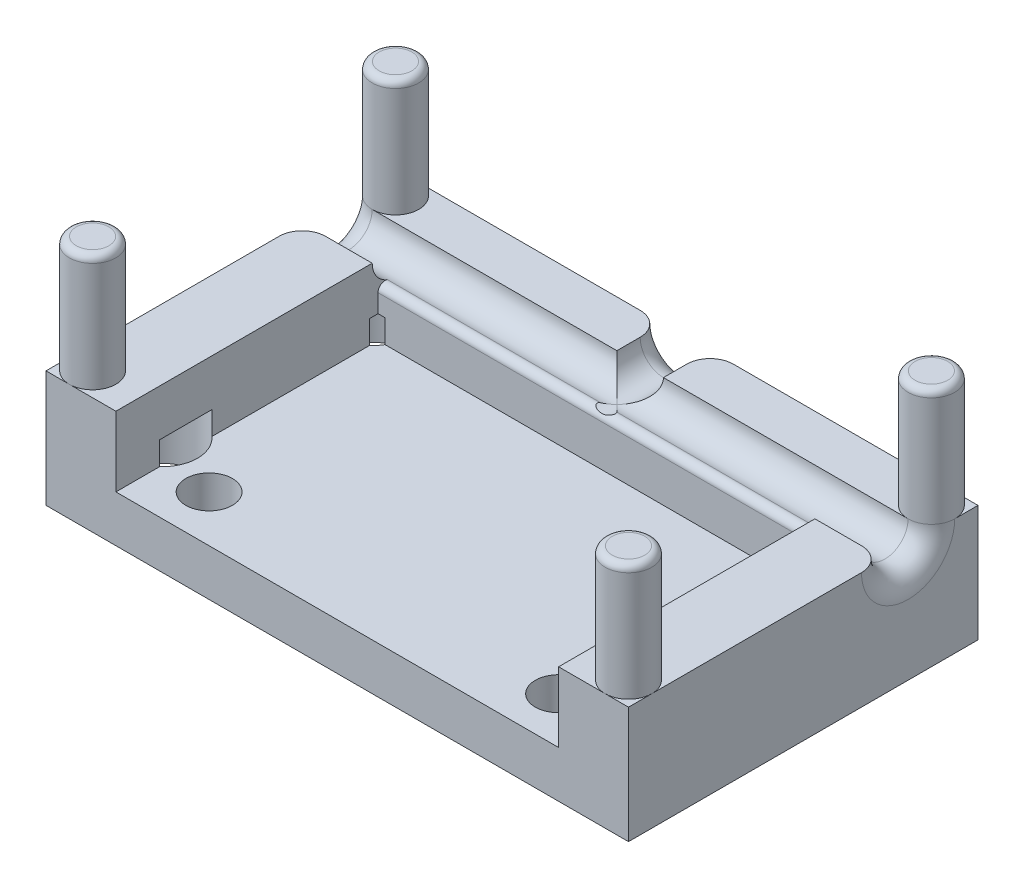
from build123d import *

# Parameters (mm, degrees)
SKETCH1_W               = 25
SKETCH1_H               = 15
BOSS_EXTRUDE1_DEPTH     = 5
CUT_EXTRUDE1_DEPTH      = 27.575364532
CUT_EXTRUDE1_DEPTH_BACK = 27.575364532
SKETCH2_R               = 1
FILLET1_R               = 1
SKETCH3_R               = 1
BOSS_EXTRUDE2_DEPTH     = 5
SKETCH4_W               = 19
SKETCH4_H               = 11.25
CUT_EXTRUDE2_DEPTH      = 3
SKETCH5_R               = 1
CUT_EXTRUDE3_DEPTH      = 3
FILLET2_R               = 0.3
FILLET3_R               = 0.3
CUT_EXTRUDE4_DEPTH      = 18.677669643
CUT_EXTRUDE4_DEPTH_BACK = 3
SKETCH6_R               = 1.5
CUT_EXTRUDE5_DEPTH      = 22.937411094
CUT_EXTRUDE5_DEPTH_BACK = 22.937411094
SKETCH7_R               = 1
FILLET4_R               = 1


with BuildPart() as part:
    # Sketch1 → Boss-Extrude1 (new body)
    with BuildSketch(Plane(origin=(0, 0, 0), x_dir=(1, 0, 0), z_dir=(0, 1, 0))):
        Rectangle(SKETCH1_W, SKETCH1_H)
    extrude(amount=BOSS_EXTRUDE1_DEPTH)

    # Sketch2 → Cut-Extrude1 (cut, two sides: drawn at the far end of the back side and taken through both)
    with BuildSketch(Plane.ZY.offset(12.5).offset(-CUT_EXTRUDE1_DEPTH_BACK)):
        with Locations((-4.5, 5)):
            Circle(SKETCH2_R)
    extrude(amount=CUT_EXTRUDE1_DEPTH + CUT_EXTRUDE1_DEPTH_BACK, mode=Mode.SUBTRACT)

    # Fillet1
    fillet1_edges = [part.edges().sort_by_distance(p)[0] for p in [
        (12.5, 4, -4.5),
        (-12.5, 4, -4.5),
    ]]
    fillet(fillet1_edges, radius=FILLET1_R)

    # Sketch3 → Boss-Extrude2 (add)
    with BuildSketch(Plane(origin=(0, 5, 0), x_dir=(1, 0, 0), z_dir=(0, 1, 0))):
        with Locations((-11.5, 6.5)):
            Circle(SKETCH3_R)
        with Locations((11.5, 6.5)):
            Circle(SKETCH3_R)
        with Locations((11.5, -6.5)):
            Circle(SKETCH3_R)
        with Locations((-11.5, -6.5)):
            Circle(SKETCH3_R)
    extrude(amount=BOSS_EXTRUDE2_DEPTH)

    # Sketch4 → Cut-Extrude2 (cut)
    with BuildSketch(Plane(origin=(0, 5, 0), x_dir=(1, 0, 0), z_dir=(0, 1, 0))):
        with Locations((0, -1.875)):
            Rectangle(SKETCH4_W, SKETCH4_H)
    extrude(amount=-CUT_EXTRUDE2_DEPTH, mode=Mode.SUBTRACT)

    # Sketch5 → Cut-Extrude3 (cut)
    with BuildSketch(Plane(origin=(0, 2, 0), x_dir=(1, 0, 0), z_dir=(0, 1, 0))):
        with Locations((-7.5, -5.5)):
            Circle(SKETCH5_R)
        with Locations((7.5, -5.5)):
            Circle(SKETCH5_R)
    extrude(amount=-CUT_EXTRUDE3_DEPTH, mode=Mode.SUBTRACT)

    # Fillet2
    fillet2_edges = [part.edges().sort_by_distance(p)[0] for p in [
        (10.5, 10, 6.5),
        (10.5, 10, -6.5),
        (-12.5, 10, -6.5),
        (-12.5, 10, 6.5),
    ]]
    fillet(fillet2_edges, radius=FILLET2_R)

    # Fillet3
    fillet3_edges = [part.edges().sort_by_distance(p)[0] for p in [
        (0, 4.338562172, -3.75),
    ]]
    fillet(fillet3_edges, radius=FILLET3_R)

    # Sketch6 → Cut-Extrude4 (cut, two sides: drawn at the far end of the back side and taken through both)
    with BuildSketch(Plane.XZ.offset(-CUT_EXTRUDE4_DEPTH_BACK)):
        with Locations((-10.5, 4.5)):
            Circle(SKETCH6_R)
        with Locations((10.5, 4.5)):
            Circle(SKETCH6_R)
        with Locations((10.5, -4.5)):
            Circle(SKETCH6_R)
        with Locations((-10.5, -4.5)):
            Circle(SKETCH6_R)
    extrude(amount=CUT_EXTRUDE4_DEPTH + CUT_EXTRUDE4_DEPTH_BACK, mode=Mode.SUBTRACT)

    # Sketch7 → Cut-Extrude5 (cut, two sides: drawn at the far end of the back side and taken through both)
    with BuildSketch(Plane(origin=(0, 0, -7.5), x_dir=(-1, 0, 0), z_dir=(0, 0, -1)).offset(-CUT_EXTRUDE5_DEPTH_BACK)):
        with Locations((0, 5)):
            Circle(SKETCH7_R)
    extrude(amount=CUT_EXTRUDE5_DEPTH + CUT_EXTRUDE5_DEPTH_BACK, mode=Mode.SUBTRACT)

    # Fillet4
    fillet4_edges = [part.edges().sort_by_distance(p)[0] for p in [
        (0, 4, -7.5),
    ]]
    fillet(fillet4_edges, radius=FILLET4_R)


solid = part.part
